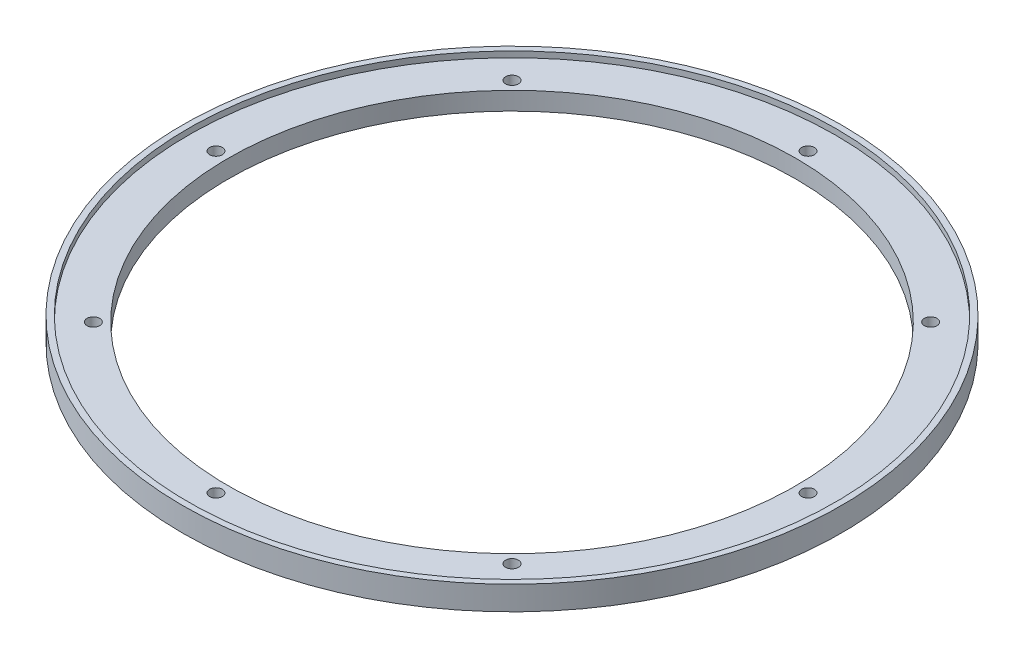
from build123d import *

# Parameters (mm, degrees)
CUT_EXTRUDE_1_REACH = 159.944
SKETCH_2_R          = 2.15


with BuildPart() as part:
    # 草图1 → 旋转1 (revolve)
    with BuildSketch(Plane.XY):
        Polygon((111.6, 6.1), (111.6, 8.1), (109.6, 8.1), (109.6, 6.1), (96.1, 6.1), (96.1, 0), (111.6, 0), align=None)
    revolve(axis=Axis((0, 0, 0), (0, 1, 0)))

    # 草图2 → 切除-拉伸1 (cut, up to next)
    with BuildSketch(Plane(origin=(0, 6.1, 0), x_dir=(1, 0, 0), z_dir=(0, 1, 0)), mode=Mode.PRIVATE) as cut_extrude_1_sk1:
        with Locations((-100.25, 0)):
            Circle(SKETCH_2_R)
    cut_extrude_1_tool1 = extrude(cut_extrude_1_sk1.sketch, amount=-CUT_EXTRUDE_1_REACH, mode=Mode.PRIVATE) & part.part
    # 草图2 → 切除-拉伸1 (cut, up to next)
    with BuildSketch(Plane(origin=(0, 6.1, 0), x_dir=(1, 0, 0), z_dir=(0, 1, 0)), mode=Mode.PRIVATE) as cut_extrude_1_sk2:
        with Locations((-70.887454814, 70.887454814)):
            Circle(SKETCH_2_R)
    cut_extrude_1_tool2 = extrude(cut_extrude_1_sk2.sketch, amount=-CUT_EXTRUDE_1_REACH, mode=Mode.PRIVATE) & part.part
    # 草图2 → 切除-拉伸1 (cut, up to next)
    with BuildSketch(Plane(origin=(0, 6.1, 0), x_dir=(1, 0, 0), z_dir=(0, 1, 0)), mode=Mode.PRIVATE) as cut_extrude_1_sk3:
        with Locations((0, 100.25)):
            Circle(SKETCH_2_R)
    cut_extrude_1_tool3 = extrude(cut_extrude_1_sk3.sketch, amount=-CUT_EXTRUDE_1_REACH, mode=Mode.PRIVATE) & part.part
    # 草图2 → 切除-拉伸1 (cut, up to next)
    with BuildSketch(Plane(origin=(0, 6.1, 0), x_dir=(1, 0, 0), z_dir=(0, 1, 0)), mode=Mode.PRIVATE) as cut_extrude_1_sk4:
        with Locations((70.887454814, 70.887454814)):
            Circle(SKETCH_2_R)
    cut_extrude_1_tool4 = extrude(cut_extrude_1_sk4.sketch, amount=-CUT_EXTRUDE_1_REACH, mode=Mode.PRIVATE) & part.part
    # 草图2 → 切除-拉伸1 (cut, up to next)
    with BuildSketch(Plane(origin=(0, 6.1, 0), x_dir=(1, 0, 0), z_dir=(0, 1, 0)), mode=Mode.PRIVATE) as cut_extrude_1_sk5:
        with Locations((100.25, 0)):
            Circle(SKETCH_2_R)
    cut_extrude_1_tool5 = extrude(cut_extrude_1_sk5.sketch, amount=-CUT_EXTRUDE_1_REACH, mode=Mode.PRIVATE) & part.part
    # 草图2 → 切除-拉伸1 (cut, up to next)
    with BuildSketch(Plane(origin=(0, 6.1, 0), x_dir=(1, 0, 0), z_dir=(0, 1, 0)), mode=Mode.PRIVATE) as cut_extrude_1_sk6:
        with Locations((70.887454814, -70.887454814)):
            Circle(SKETCH_2_R)
    cut_extrude_1_tool6 = extrude(cut_extrude_1_sk6.sketch, amount=-CUT_EXTRUDE_1_REACH, mode=Mode.PRIVATE) & part.part
    # 草图2 → 切除-拉伸1 (cut, up to next)
    with BuildSketch(Plane(origin=(0, 6.1, 0), x_dir=(1, 0, 0), z_dir=(0, 1, 0)), mode=Mode.PRIVATE) as cut_extrude_1_sk7:
        with Locations((0, -100.25)):
            Circle(SKETCH_2_R)
    cut_extrude_1_tool7 = extrude(cut_extrude_1_sk7.sketch, amount=-CUT_EXTRUDE_1_REACH, mode=Mode.PRIVATE) & part.part
    # 草图2 → 切除-拉伸1 (cut, up to next)
    with BuildSketch(Plane(origin=(0, 6.1, 0), x_dir=(1, 0, 0), z_dir=(0, 1, 0)), mode=Mode.PRIVATE) as cut_extrude_1_sk8:
        with Locations((-70.887454814, -70.887454814)):
            Circle(SKETCH_2_R)
    cut_extrude_1_tool8 = extrude(cut_extrude_1_sk8.sketch, amount=-CUT_EXTRUDE_1_REACH, mode=Mode.PRIVATE) & part.part
    add(cut_extrude_1_tool1.solids().sort_by_distance((-100.25, 6.1, 0))[0], mode=Mode.SUBTRACT)
    add(cut_extrude_1_tool2.solids().sort_by_distance((-70.887455, 6.1, -70.887455))[0], mode=Mode.SUBTRACT)
    add(cut_extrude_1_tool3.solids().sort_by_distance((0, 6.1, -100.25))[0], mode=Mode.SUBTRACT)
    add(cut_extrude_1_tool4.solids().sort_by_distance((70.887455, 6.1, -70.887455))[0], mode=Mode.SUBTRACT)
    add(cut_extrude_1_tool5.solids().sort_by_distance((100.25, 6.1, 0))[0], mode=Mode.SUBTRACT)
    add(cut_extrude_1_tool6.solids().sort_by_distance((70.887455, 6.1, 70.887455))[0], mode=Mode.SUBTRACT)
    add(cut_extrude_1_tool7.solids().sort_by_distance((0, 6.1, 100.25))[0], mode=Mode.SUBTRACT)
    add(cut_extrude_1_tool8.solids().sort_by_distance((-70.887455, 6.1, 70.887455))[0], mode=Mode.SUBTRACT)


solid = part.part
